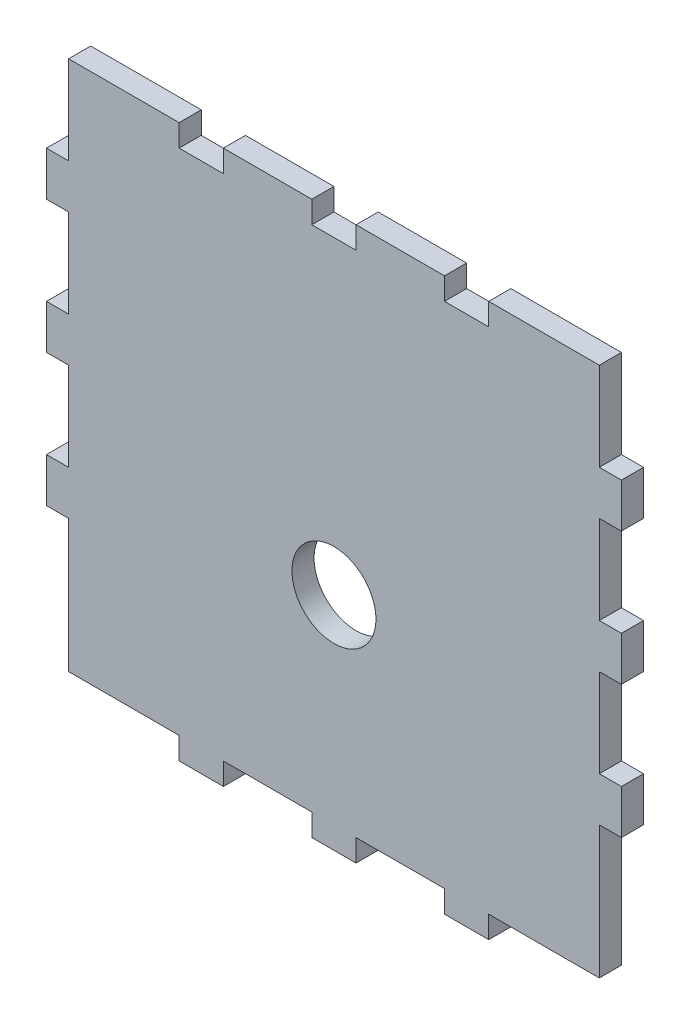
from build123d import *

# Parameters (mm, degrees)
SKETCH1_R           = 9.5
BOSS_EXTRUDE1_DEPTH = 5


with BuildPart() as part:
    # Sketch1 → Boss-Extrude1 (new body)
    with BuildSketch(Plane.XY):
        Polygon((-35, 55), (-35, 60), (-60, 60), (-60, 40), (-65, 40), (-65, 30), (-60, 30), (-60, 10), (-65, 10), (-65, 0), (-60, 0), (-60, -20), (-65, -20), (-65, -30), (-60, -30), (-60, -50), (-60, -60), (-35, -60), (-35, -65), (-25, -65), (-25, -60), (-5, -60), (-5, -65), (5, -65), (5, -60), (25, -60), (25, -65), (35, -65), (35, -60), (60, -60), (60, -50), (60, -30), (65, -30), (65, -20), (60, -20), (60, 0), (65, 0), (65, 10), (60, 10), (60, 30), (65, 30), (65, 40), (60, 40), (60, 60), (35, 60), (35, 55), (25, 55), (25, 60), (5, 60), (5, 55), (-5, 55), (-5, 60), (-25, 60), (-25, 55), align=None)
        with Locations((0, -15)):
            Circle(SKETCH1_R, mode=Mode.SUBTRACT)
    extrude(amount=BOSS_EXTRUDE1_DEPTH)


solid = part.part
